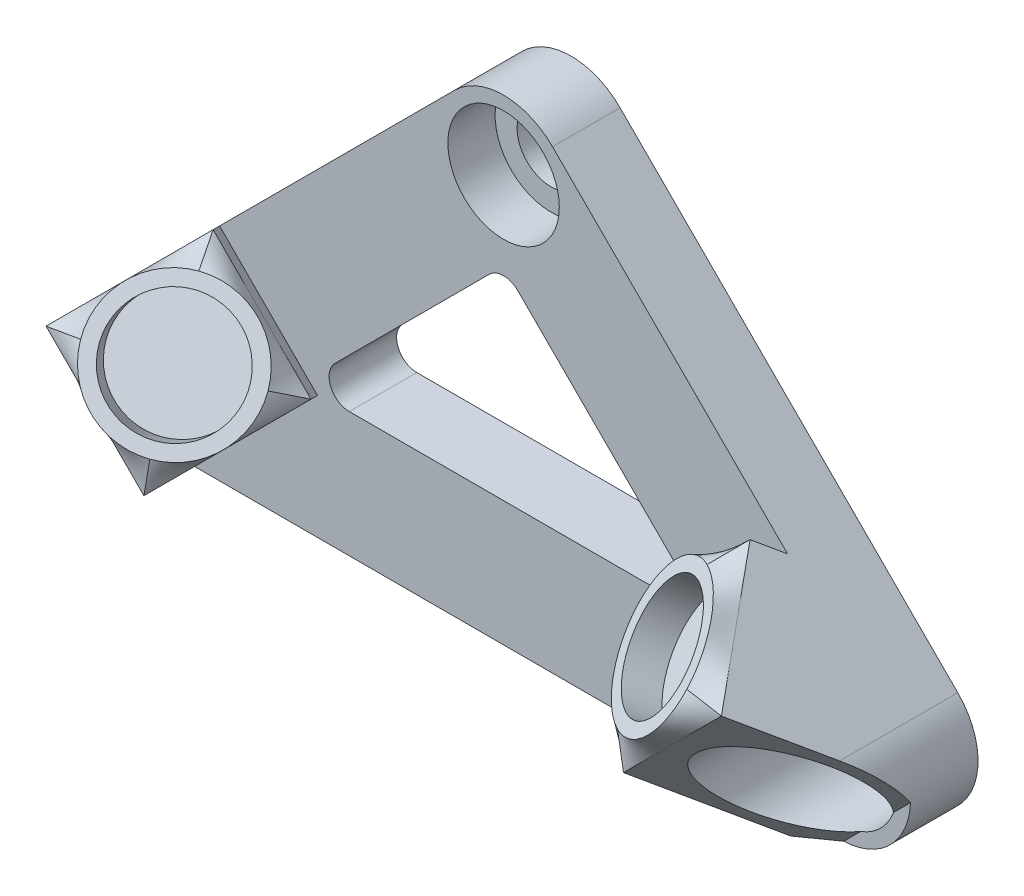
from build123d import *
from build123d.topology import SkipClean

# Parameters (mm, degrees)
BOSS_EXTRUDE1_DEPTH = 10
SKETCH2_R           = 8.25
CUT_EXTRUDE1_DEPTH  = 7
CUT_EXTRUDE2_DEPTH  = 16
FILLET2_R           = 3
SKETCH5_R           = 5
CUT_EXTRUDE3_DEPTH  = 16
BOSS_EXTRUDE2_DEPTH = 20.5
CUT_EXTRUDE4_START  = 20
SKETCH7_R           = 8.25
SKETCH7_R_2         = 5
CUT_EXTRUDE4_DEPTH  = 20
SKETCH9_R           = 8.25
CUT_EXTRUDE5_DEPTH  = 5
SKETCH10_W          = 60.25
SKETCH10_H          = 70.5
CUT_EXTRUDE6_DEPTH  = 45


with BuildPart() as part:
    # Sketch1 → Boss-Extrude1 (new body)
    with BuildSketch(Plane.XY):
        with BuildLine():
            Line((0, 10.25), (100, 10.25))
            ThreePointArc((100, 10.25), (110.25, 0), (100, -10.25))
            Line((100, -10.25), (0, -10.25))
            ThreePointArc((0, -10.25), (-10.25, 0), (0, 10.25))
        make_face()
        with BuildLine():
            Line((92.752155493, -7.247844507), (42.752155493, 42.752155493))
            ThreePointArc((42.752155493, 42.752155493), (42.752155493, 57.247844507), (57.247844507, 57.247844507))
            Line((57.247844507, 57.247844507), (107.247844507, 7.247844507))
            ThreePointArc((107.247844507, 7.247844507), (107.247844507, -7.247844507), (92.752155493, -7.247844507))
        make_face()
        with BuildLine():
            Line((57.247844507, 42.752155493), (7.247844507, -7.247844507))
            ThreePointArc((7.247844507, -7.247844507), (-7.247844507, -7.247844507), (-7.247844507, 7.247844507))
            Line((-7.247844507, 7.247844507), (42.752155493, 57.247844507))
            ThreePointArc((42.752155493, 57.247844507), (57.247844507, 57.247844507), (57.247844507, 42.752155493))
        make_face()
    extrude(amount=BOSS_EXTRUDE1_DEPTH)

    # Sketch2 → Cut-Extrude1 (cut)
    with BuildSketch(Plane.XY.offset(10)):
        with Locations((50, 50)):
            Circle(SKETCH2_R)
        with Locations((100, 0)):
            Circle(SKETCH2_R)
        Circle(SKETCH2_R)
    extrude(amount=-CUT_EXTRUDE1_DEPTH, mode=Mode.SUBTRACT)

    # Sketch4 → Cut-Extrude2 (cut)
    with BuildSketch(Plane.XY.offset(10)):
        Polygon((19.91726189, 8.25), (80.08273811, 8.25), (50, 38.33273811), align=None)
    extrude(amount=-CUT_EXTRUDE2_DEPTH, mode=Mode.SUBTRACT)

    # Fillet2
    fillet2_edges = [part.edges().sort_by_distance(p)[0] for p in [
        (19.91726189, 8.25, 5),
        (50, 38.33273811, 5),
        (80.08273811, 8.25, 5),
    ]]
    fillet(fillet2_edges, radius=FILLET2_R)

    # Sketch5 → Cut-Extrude3 (cut)
    with BuildSketch(Plane.XY.offset(10)):
        Circle(SKETCH5_R)
        with Locations((50, 50)):
            Circle(SKETCH5_R)
        with Locations((100, 0)):
            Circle(SKETCH5_R)
    extrude(amount=-CUT_EXTRUDE3_DEPTH, mode=Mode.SUBTRACT)

    # Sketch6 → Boss-Extrude2 (add)
    with BuildSketch(Plane(origin=(-7.247844507, 7.247844507, 0), x_dir=(0, 0, 1), z_dir=(-0.7071067811865441, 0.7071067811865509, 0))):
        Polygon((10, 21.495689014), (10, 7), (20.500892834, 17.500892834), (13.253048327, 24.748737342), align=None)
        Polygon((20.500892834, 17.500892834), (10, 7), (10, 0), (10, -7.495689014), (27.748737342, 10.253048327), align=None)
    extrude(amount=-BOSS_EXTRUDE2_DEPTH)

    # Sketch7 → Cut-Extrude4 (cut)
    # profile 1 of 3: a face of its own
    with BuildSketch(Plane.XY.offset(10).offset(CUT_EXTRUDE4_START)):
        with BuildLine():
            Line((20, -20.25), (20, -10.25))
            Line((20, -10.25), (4.245689014, -10.25))
            Line((4.245689014, -10.25), (0, -10.25))
            ThreePointArc((0, -10.25), (-9.469765208, -3.922505182), (-7.247844507, 7.247844507))
            Line((-7.247844507, 7.247844507), (7.951902961, 22.447591975))
            Line((7.951902961, 22.447591975), (15.254310986, 29.75))
            Line((15.254310986, 29.75), (-20, 29.75))
            Line((-20, 29.75), (-20, -20.25))
            Line((-20, -20.25), (20, -20.25))
        make_face()
    # profile 2 of 3: a face of its own
    with BuildSketch(Plane.XY.offset(10).offset(CUT_EXTRUDE4_START)):
        Circle(SKETCH7_R)
        Circle(SKETCH7_R_2, mode=Mode.SUBTRACT)
    # profile 3 of 3: a face of its own
    with BuildSketch(Plane.XY.offset(10).offset(CUT_EXTRUDE4_START)):
        Circle(SKETCH7_R_2)
    extrude(amount=-CUT_EXTRUDE4_DEPTH, mode=Mode.SUBTRACT)

    # Loft1: read off the stored shape, not the designer's step
    # Loft1: loft between two sections, ruled curve by curve
    loft1_from = [
        Edge.make_bspline([(12.373922254, 22.623922254, 17.497213178), (12.889457441, 22.535470399, 17.195219657), (13.432134989, 22.397880865, 16.908779176), (14.549790596, 22.011562197, 16.391645867), (15.124688663, 21.762676267, 16.161120474), (16.274806274, 21.151537295, 15.780005023), (16.849824782, 20.789221108, 15.629601769), (17.962375724, 19.963587433, 15.426720624), (18.499640751, 19.500359249, 15.374368671), (19.500359249, 18.499640751, 15.374368671), (19.963587433, 17.962375724, 15.426720624), (20.789221108, 16.849824782, 15.629601769), (21.151537295, 16.274806274, 15.780005023), (21.762676267, 15.124688663, 16.161120474), (22.011562197, 14.549790596, 16.391645867), (22.397880865, 13.432134989, 16.908779176), (22.535470399, 12.889457441, 17.195219657), (22.623922254, 12.373922254, 17.497213178)], [0, 0, 0, 0, 0.125, 0.125, 0.25, 0.25, 0.375, 0.375, 0.5, 0.5, 0.625, 0.625, 0.75, 0.75, 0.875, 0.875, 1, 1, 1, 1], 3),
        Edge.make_bspline([(22.623922254, 12.373922254, 17.497213178), (22.712374108, 11.858387066, 17.799206699), (22.758303856, 11.331435851, 18.13934024), (22.743701961, 10.282567338, 18.891327377), (22.682975729, 9.76079032, 19.303219376), (22.441392942, 8.756976633, 20.183847667), (22.260398337, 8.27517552, 20.652515015), (21.778027739, 7.387042631, 21.621607323), (21.476651925, 6.980962911, 22.121853929), (20.769037089, 6.273348075, 23.122572427), (20.362957369, 5.971972261, 23.622819032), (19.47482448, 5.489601663, 24.591911341), (18.993023367, 5.308607058, 25.060578689), (17.98920968, 5.067024271, 25.94120698), (17.467432662, 5.006298039, 26.353098979), (16.418564149, 4.991696144, 27.105086116), (15.891612934, 5.037625892, 27.445219657), (15.376077746, 5.126077746, 27.747213178)], [0, 0, 0, 0, 0.125, 0.125, 0.25, 0.25, 0.375, 0.375, 0.5, 0.5, 0.625, 0.625, 0.75, 0.75, 0.875, 0.875, 1, 1, 1, 1], 3),
        Edge.make_bspline([(5.126077746, 15.376077746, 27.747213178), (5.037625892, 15.891612934, 27.445219657), (4.991696144, 16.418564149, 27.105086116), (5.006298039, 17.467432662, 26.353098979), (5.067024271, 17.98920968, 25.94120698), (5.308607058, 18.993023367, 25.060578689), (5.489601663, 19.47482448, 24.591911341), (5.971972261, 20.362957369, 23.622819032), (6.273348075, 20.769037089, 23.122572427), (6.980962911, 21.476651925, 22.121853929), (7.387042631, 21.778027739, 21.621607323), (8.27517552, 22.260398337, 20.652515015), (8.756976633, 22.441392942, 20.183847667), (9.76079032, 22.682975729, 19.303219376), (10.282567338, 22.743701961, 18.891327377), (11.331435851, 22.758303856, 18.13934024), (11.858387066, 22.712374108, 17.799206699), (12.373922254, 22.623922254, 17.497213178)], [0, 0, 0, 0, 0.125, 0.125, 0.25, 0.25, 0.375, 0.375, 0.5, 0.5, 0.625, 0.625, 0.75, 0.75, 0.875, 0.875, 1, 1, 1, 1], 3),
        Edge.make_bspline([(15.376077746, 5.126077746, 27.747213178), (14.860542559, 5.214529601, 28.049206699), (14.317865011, 5.352119135, 28.33564718), (13.200209404, 5.738437803, 28.852780489), (12.625311337, 5.987323733, 29.083305882), (11.475193726, 6.598462705, 29.464421332), (10.900175218, 6.960778892, 29.614824586), (9.787624276, 7.786412567, 29.817705732), (9.250359249, 8.249640751, 29.870057685), (8.249640751, 9.250359249, 29.870057685), (7.786412567, 9.787624276, 29.817705732), (6.960778892, 10.900175218, 29.614824586), (6.598462705, 11.475193726, 29.464421332), (5.987323733, 12.625311337, 29.083305882), (5.738437803, 13.200209404, 28.852780489), (5.352119135, 14.317865011, 28.33564718), (5.214529601, 14.860542559, 28.049206699), (5.126077746, 15.376077746, 27.747213178)], [0, 0, 0, 0, 0.125, 0.125, 0.25, 0.25, 0.375, 0.375, 0.5, 0.5, 0.625, 0.625, 0.75, 0.75, 0.875, 0.875, 1, 1, 1, 1], 3),
    ]
    loft1_to = [
        Edge.make_bspline([(10.252155493, 24.747844507, 13.253048327), (10.856142535, 24.143857465, 13.253048327), (11.460129577, 23.539870423, 13.253048327), (12.668103662, 22.331896338, 13.253048327), (13.272090704, 21.727909296, 13.253048327), (14.480064789, 20.519935211, 13.253048327), (15.084051831, 19.915948169, 13.253048327), (16.292025915, 18.707974085, 13.253048327), (16.896012958, 18.103987042, 13.253048327), (18.103987042, 16.896012958, 13.253048327), (18.707974085, 16.292025915, 13.253048327), (19.915948169, 15.084051831, 13.253048327), (20.519935211, 14.480064789, 13.253048327), (21.727909296, 13.272090704, 13.253048327), (22.331896338, 12.668103662, 13.253048327), (23.539870423, 11.460129577, 13.253048327), (24.143857465, 10.856142535, 13.253048327), (24.747844507, 10.252155493, 13.253048327)], [0, 0, 0, 0, 0.125, 0.125, 0.25, 0.25, 0.375, 0.375, 0.5, 0.5, 0.625, 0.625, 0.75, 0.75, 0.875, 0.875, 1, 1, 1, 1], 3),
        Edge.make_bspline([(24.747844507, 10.252155493, 13.253048327), (24.320761174, 9.82507216, 13.857035369), (23.89367784, 9.397988826, 14.461022412), (23.039511174, 8.54382216, 15.668996496), (22.61242784, 8.116738826, 16.272983539), (21.758261174, 7.26257216, 17.480957623), (21.33117784, 6.835488826, 18.084944665), (20.477011174, 5.98132216, 19.29291875), (20.04992784, 5.554238826, 19.896905792), (19.195761174, 4.70007216, 21.104879877), (18.76867784, 4.272988826, 21.708866919), (17.914511174, 3.41882216, 22.916841003), (17.48742784, 2.991738826, 23.520828046), (16.633261174, 2.13757216, 24.72880213), (16.20617784, 1.710488826, 25.332789172), (15.352011174, 0.85632216, 26.540763257), (14.92492784, 0.429238826, 27.144750299), (14.497844507, 0.002155493, 27.748737342)], [0, 0, 0, 0, 0.125, 0.125, 0.25, 0.25, 0.375, 0.375, 0.5, 0.5, 0.625, 0.625, 0.75, 0.75, 0.875, 0.875, 1, 1, 1, 1], 3),
        Edge.make_bspline([(0.002155493, 14.497844507, 27.748737342), (0.429238826, 14.92492784, 27.144750299), (0.85632216, 15.352011174, 26.540763257), (1.710488826, 16.20617784, 25.332789172), (2.13757216, 16.633261174, 24.72880213), (2.991738826, 17.48742784, 23.520828046), (3.41882216, 17.914511174, 22.916841003), (4.272988826, 18.76867784, 21.708866919), (4.70007216, 19.195761174, 21.104879877), (5.554238826, 20.04992784, 19.896905792), (5.98132216, 20.477011174, 19.29291875), (6.835488826, 21.33117784, 18.084944665), (7.26257216, 21.758261174, 17.480957623), (8.116738826, 22.61242784, 16.272983539), (8.54382216, 23.039511174, 15.668996496), (9.397988826, 23.89367784, 14.461022412), (9.82507216, 24.320761174, 13.857035369), (10.252155493, 24.747844507, 13.253048327)], [0, 0, 0, 0, 0.125, 0.125, 0.25, 0.25, 0.375, 0.375, 0.5, 0.5, 0.625, 0.625, 0.75, 0.75, 0.875, 0.875, 1, 1, 1, 1], 3),
        Edge.make_bspline([(14.497844507, 0.002155493, 27.748737342), (13.893857465, 0.606142535, 27.748737342), (13.289870423, 1.210129577, 27.748737342), (12.081896338, 2.418103662, 27.748737342), (11.477909296, 3.022090704, 27.748737342), (10.269935211, 4.230064789, 27.748737342), (9.665948169, 4.834051831, 27.748737342), (8.457974085, 6.042025915, 27.748737342), (7.853987042, 6.646012958, 27.748737342), (6.646012958, 7.853987042, 27.748737342), (6.042025915, 8.457974085, 27.748737342), (4.834051831, 9.665948169, 27.748737342), (4.230064789, 10.269935211, 27.748737342), (3.022090704, 11.477909296, 27.748737342), (2.418103662, 12.081896338, 27.748737342), (1.210129577, 13.289870423, 27.748737342), (0.606142535, 13.893857465, 27.748737342), (0.002155493, 14.497844507, 27.748737342)], [0, 0, 0, 0, 0.125, 0.125, 0.25, 0.25, 0.375, 0.375, 0.5, 0.5, 0.625, 0.625, 0.75, 0.75, 0.875, 0.875, 1, 1, 1, 1], 3),
    ]
    loft1 = Solid(Shell([*[Face.make_surface_from_curves(loft1_from[k], loft1_to[k]) for k in range(4)], Face(Wire(loft1_from)), Face(Wire(loft1_to))]))
    add(loft1)

    # Sketch9 → Cut-Extrude5 (cut)
    with BuildSketch(Plane(origin=(14.935660172, 14.935660172, 21.122213178), x_dir=(0.8660254037844357, -0.2886751345948172, -0.40824829046386635), z_dir=(0.5000000000000052, 0.5000000000000007, 0.7071067811865435))):
        with Locations(Location((-1.224744871, -1.732050808, 0), (0, 0, 19.471220634))):
            Circle(SKETCH9_R)
    extrude(amount=-CUT_EXTRUDE5_DEPTH, mode=Mode.SUBTRACT)

    # Sketch10 → Cut-Extrude6 (cut)
    with BuildSketch(Plane(origin=(0, 0, 0), x_dir=(-1, 0, 0), z_dir=(0, 0, -1))):
        with Locations((-80.125, 25)):
            Rectangle(SKETCH10_W, SKETCH10_H)
    extrude(amount=-CUT_EXTRUDE6_DEPTH, mode=Mode.SUBTRACT)

    # Mirror1: part across plane


with BuildPart() as part_1:
    with SkipClean():  # the faces are left unmerged after this step: merging them gives an invalid solid
        add(part.part)
        add(part.part.mirror(Plane(origin=(50, 60.25, 45), x_dir=(0, 0, 1), z_dir=(-1, 0, 0))))


solid = part_1.part
